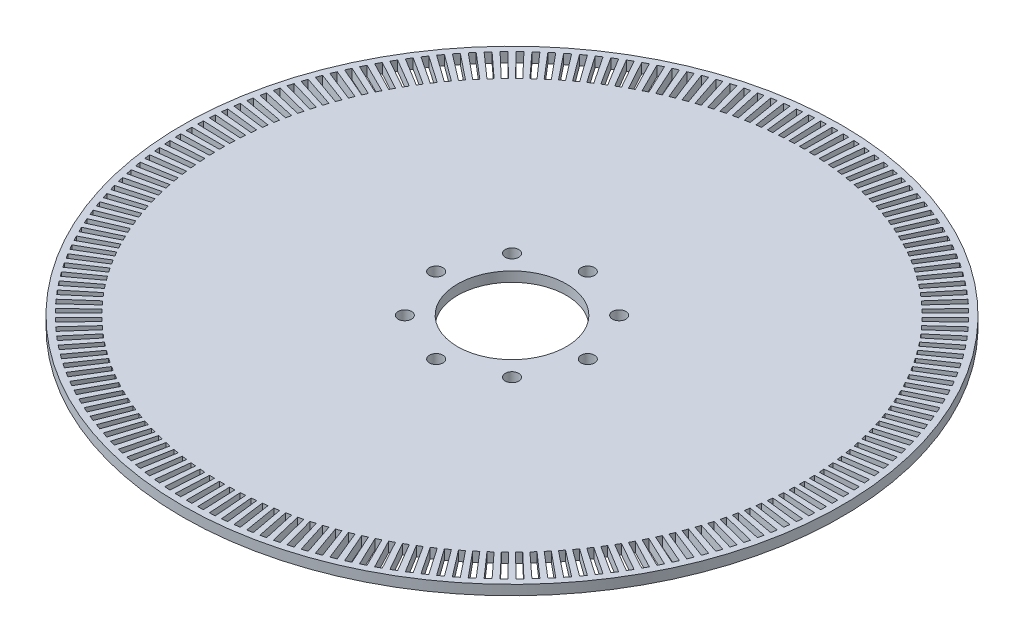
from build123d import *

# Parameters (mm, degrees)
SKETCH1_R           = 100
SKETCH1_R_2         = 16.5
BOSS_EXTRUDE1_DEPTH = 3
SKETCH2_R           = 2.05
CUT_EXTRUDE1_DEPTH  = 142.453172464
CIRPATTERN1_COUNT   = 8
CUT_EXTRUDE2_DEPTH  = 142.453172464
CIRPATTERN2_COUNT   = 180


with BuildPart() as part:
    # Sketch1 → Boss-Extrude1 (new body)
    with BuildSketch(Plane(origin=(0, 0, 0), x_dir=(1, 0, 0), z_dir=(0, 1, 0))):
        with Locations(Location((0, 0, 0), (0, 0, 270))):
            Circle(SKETCH1_R)
        with Locations(Location((0, 0, 0), (0, 0, 270))):
            Circle(SKETCH1_R_2, mode=Mode.SUBTRACT)
    extrude(amount=BOSS_EXTRUDE1_DEPTH)

    # Sketch2 → Cut-Extrude1 (cut, through all)
    with BuildSketch(Plane(origin=(0, 3, 0), x_dir=(1, 0, 0), z_dir=(0, 1, 0))):
        with Locations(Location((23, 0, 0), (0, 0, 270))):
            Circle(SKETCH2_R)
    cut_extrude1 = extrude(amount=-CUT_EXTRUDE1_DEPTH, mode=Mode.SUBTRACT)

    # CirPattern1: Cut-Extrude1 ×8 about axis
    cirpattern1_axis = Axis((0, 0, 0), (0, 1, 0))
    for i in range(1, CIRPATTERN1_COUNT):
        add(cut_extrude1.rotate(cirpattern1_axis, i * 360 / CIRPATTERN1_COUNT), mode=Mode.SUBTRACT)

    # Sketch3 → Cut-Extrude2 (cut, through all)
    with BuildSketch(Plane(origin=(0, 3, 0), x_dir=(1, 0, 0), z_dir=(0, 1, 0))):
        with BuildLine():
            Line((87.99664923, 0.767935124), (97.99626846, 0.855200479))
            ThreePointArc((97.99626846, 0.855200479), (98, 0), (97.99626846, -0.855200479))
            Line((97.99626846, -0.855200479), (87.99664923, -0.767935124))
            ThreePointArc((87.99664923, -0.767935124), (88, 0), (87.99664923, 0.767935124))
        make_face()
    cut_extrude2 = extrude(amount=-CUT_EXTRUDE2_DEPTH, mode=Mode.SUBTRACT)

    # CirPattern2: Cut-Extrude2 ×180 about axis
    cirpattern2_axis = Axis((0, 0, 0), (0, 1, 0))
    for i in range(1, CIRPATTERN2_COUNT):
        add(cut_extrude2.rotate(cirpattern2_axis, i * 360 / CIRPATTERN2_COUNT), mode=Mode.SUBTRACT)


solid = part.part
